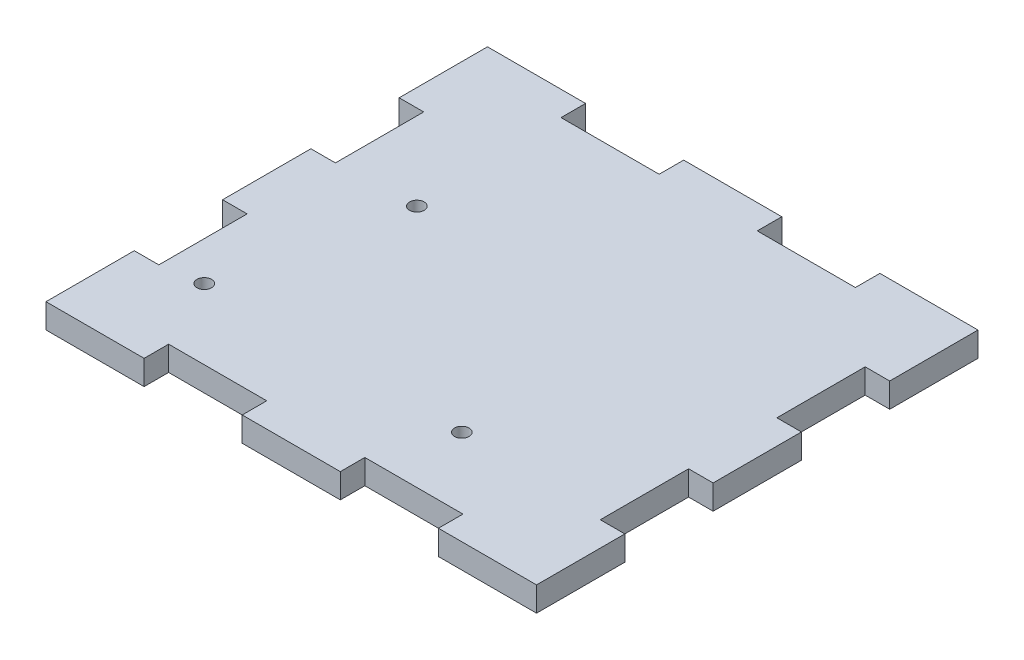
from build123d import *

# Parameters (mm, degrees)
SKETCH1_W           = 127
SKETCH1_H           = 114.3
BOSS_EXTRUDE1_DEPTH = 6.35
SKETCH2_W           = 6.35
SKETCH2_H           = 22.86
SKETCH2_W_2         = 25.4
SKETCH2_H_2         = 6.35
CUT_EXTRUDE1_DEPTH  = 86.666183527
SKETCH3_R           = 1.89865
CUT_EXTRUDE2_DEPTH  = 86.666183527
SKETCH4_R           = 1.89865
CUT_EXTRUDE3_DEPTH  = 86.666183527


with BuildPart() as part:
    # Sketch1 → Boss-Extrude1 (new body)
    with BuildSketch(Plane(origin=(0, 0, 0), x_dir=(1, 0, 0), z_dir=(0, 1, 0))):
        Rectangle(SKETCH1_W, SKETCH1_H)
    extrude(amount=BOSS_EXTRUDE1_DEPTH)

    # Sketch2 → Cut-Extrude1 (cut, through all)
    with BuildSketch(Plane(origin=(0, 6.35, 0), x_dir=(1, 0, 0), z_dir=(0, 1, 0))):
        with Locations((-60.325, -22.86)):
            Rectangle(SKETCH2_W, SKETCH2_H)
        with Locations((-60.325, 22.86)):
            Rectangle(SKETCH2_W, SKETCH2_H)
        with Locations((-25.4, 53.975)):
            Rectangle(SKETCH2_W_2, SKETCH2_H_2)
        with Locations((25.4, 53.975)):
            Rectangle(SKETCH2_W_2, SKETCH2_H_2)
        with Locations((60.325, 22.86)):
            Rectangle(SKETCH2_W, SKETCH2_H)
        with Locations((60.325, -22.86)):
            Rectangle(SKETCH2_W, SKETCH2_H)
        with Locations((25.4, -53.975)):
            Rectangle(SKETCH2_W_2, SKETCH2_H_2)
        with Locations((-25.4, -53.975)):
            Rectangle(SKETCH2_W_2, SKETCH2_H_2)
    extrude(amount=-CUT_EXTRUDE1_DEPTH, mode=Mode.SUBTRACT)

    # Sketch3 → Cut-Extrude2 (cut, through all)
    with BuildSketch(Plane(origin=(0, 6.35, 0), x_dir=(1, 0, 0), z_dir=(0, 1, 0))):
        with Locations((-47.076322948, -32.600738686)):
            Circle(SKETCH3_R)
        with Locations((19.598677052, -32.600738686)):
            Circle(SKETCH3_R)
    extrude(amount=-CUT_EXTRUDE2_DEPTH, mode=Mode.SUBTRACT)

    # Sketch4 → Cut-Extrude3 (cut, through all)
    with BuildSketch(Plane.XZ):
        with Locations((-36.916322948, -12.280738686)):
            Circle(SKETCH4_R)
    extrude(amount=-CUT_EXTRUDE3_DEPTH, mode=Mode.SUBTRACT)


solid = part.part
